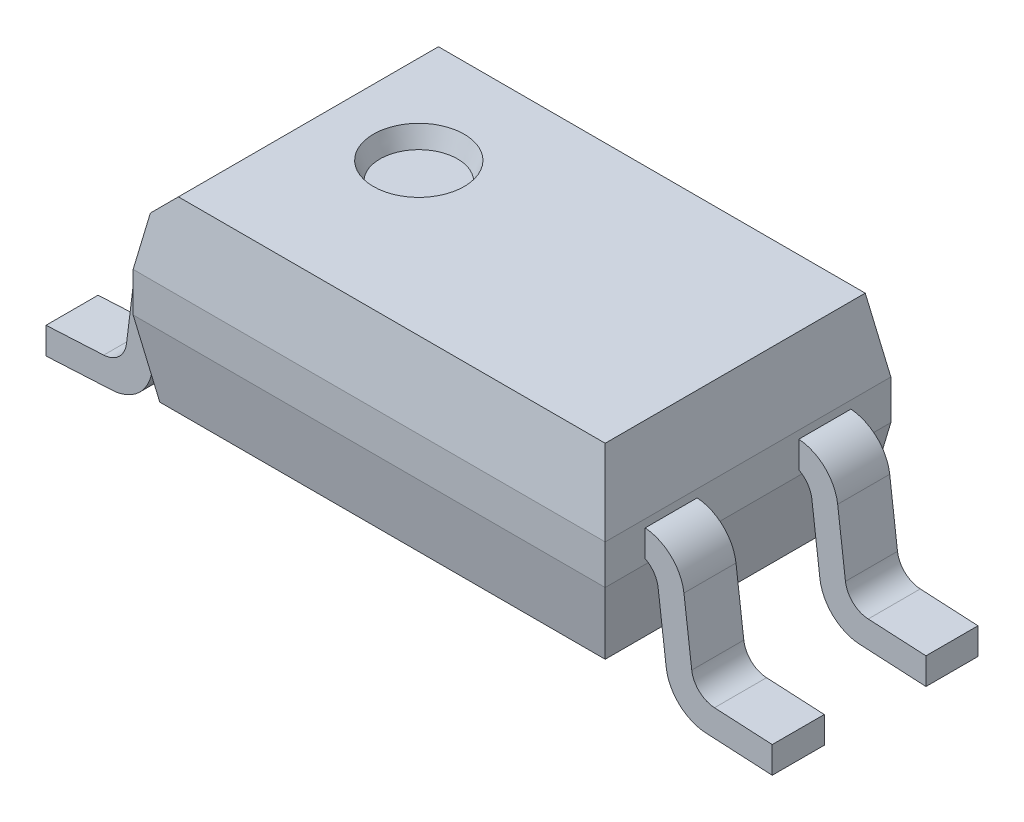
from build123d import *
from OCP.BRepFilletAPI import BRepFilletAPI_MakeChamfer

# Parameters (mm, degrees)
SKETCH1_W            = 3.9
SKETCH1_H            = 2.36
BOSS_EXTRUDE1_DEPTH  = 1.55
CHAMFER1_SIZE        = 0.11
CHAMFER1_SIZE2       = 0.623841
CHAMFER2_SIZE        = 0.6
CHAMFER2_SIZE2       = 0.105796188
CHAMFER3_SIZE        = 0.2
CHAMFER3_SIZE2       = 0.162231915
SKETCH3_R            = 0.375
MARK_PIN1_DEPTH      = 0.15
MARK_PIN1_DRAFT      = -20
PIN_EXTRUDE_DEPTH    = 0.43
FILLET1_R            = 0.2
FILLET2_R            = 0.35
FILLET1_OF_MIRROR1_R = 0.2
FILLET2_OF_MIRROR1_R = 0.35
PIN_PATTERN_START    = 0.42
PIN_PATTERN_DEPTH    = 0.43


# Read off the part's stored shape, not the designer's step: pin_pattern
with BuildPart() as part:
    # Sketch1 → Boss-Extrude1 (new body)
    with BuildSketch(Plane(origin=(0, 0.36, 0), x_dir=(1, 0, 0), z_dir=(0, 1, 0))):
        Rectangle(SKETCH1_W, SKETCH1_H)
    extrude(amount=BOSS_EXTRUDE1_DEPTH)

    # Chamfer1
    chamfer1_edges = [part.edges().sort_by_distance(p)[0] for p in [
        (0, 0.36, 1.18),
        (-1.95, 0.36, 0),
        (0, 0.36, -1.18),
        (1.95, 0.36, 0),
    ]]
    chamfer1_side = [part.faces().sort_by_distance(p)[0] for p in [
        (0, 0.36, 0),
    ]]
    chamfer(chamfer1_edges, length=CHAMFER1_SIZE, length2=CHAMFER1_SIZE2, reference=chamfer1_side[0])

    # Chamfer2: one chamfer whose edges measure the first distance from different faces: ONE call of the kernel's chamfer builder (chamfer() names one face for all edges)
    chamfer2_edges_1 = [part.edges().sort_by_distance(p)[0] for p in [
        (-1.95, 1.91, 0),
    ]]
    chamfer2_side_1 = [part.faces().sort_by_distance(p)[0] for p in [
        (-1.95, 1.4469205, 0),
    ]]
    chamfer2_edges_2 = [part.edges().sort_by_distance(p)[0] for p in [
        (0, 1.91, 1.18),
    ]]
    chamfer2_side_2 = [part.faces().sort_by_distance(p)[0] for p in [
        (0, 1.4469205, 1.18),
    ]]
    chamfer2_edges_3 = [part.edges().sort_by_distance(p)[0] for p in [
        (1.95, 1.91, 0),
    ]]
    chamfer2_side_3 = [part.faces().sort_by_distance(p)[0] for p in [
        (1.95, 1.4469205, 0),
    ]]
    chamfer2_edges_4 = [part.edges().sort_by_distance(p)[0] for p in [
        (0, 1.91, -1.18),
    ]]
    chamfer2_side_4 = [part.faces().sort_by_distance(p)[0] for p in [
        (0, 1.4469205, -1.18),
    ]]
    chamfer2 = BRepFilletAPI_MakeChamfer(part.part.solid().wrapped)
    for e in chamfer2_edges_1:
        chamfer2.Add(CHAMFER2_SIZE, CHAMFER2_SIZE2, e.wrapped, chamfer2_side_1[0].wrapped)  # the first distance lies on this face
    for e in chamfer2_edges_2:
        chamfer2.Add(CHAMFER2_SIZE, CHAMFER2_SIZE2, e.wrapped, chamfer2_side_2[0].wrapped)  # the first distance lies on this face
    for e in chamfer2_edges_3:
        chamfer2.Add(CHAMFER2_SIZE, CHAMFER2_SIZE2, e.wrapped, chamfer2_side_3[0].wrapped)  # the first distance lies on this face
    for e in chamfer2_edges_4:
        chamfer2.Add(CHAMFER2_SIZE, CHAMFER2_SIZE2, e.wrapped, chamfer2_side_4[0].wrapped)  # the first distance lies on this face
    add(Compound.cast(chamfer2.Shape()), mode=Mode.REPLACE)

    # Chamfer3
    chamfer3_edges = [part.edges().sort_by_distance(p)[0] for p in [
        (-1.844203812, 1.91, 0),
    ]]
    chamfer3_side = [part.faces().sort_by_distance(p)[0] for p in [
        (-1.897929458, 1.605306716, 0),
    ]]
    chamfer(chamfer3_edges, length=CHAMFER3_SIZE, length2=CHAMFER3_SIZE2, reference=chamfer3_side[0])


with BuildPart() as mark_pin1_tool:
    # Sketch3 → mark pin1 (with draft: the straight prism first)
    with BuildSketch(Plane(origin=(0, 1.91, 0), x_dir=(1, 0, 0), z_dir=(0, 1, 0))):
        with Locations((-0.95, 0.18)):
            Circle(SKETCH3_R)
    extrude(amount=-MARK_PIN1_DEPTH)
    # mark pin1: the draft: its side faces are tilted about the plane it starts from
    mark_pin1_sides = [mark_pin1_tool.faces().sort_by_distance(p)[0] for p in [
        (-1.325, 1.835, -0.18),
    ]]
    draft(mark_pin1_sides, Plane(origin=(0, 1.91, 0), x_dir=(1, 0, 0), z_dir=(0, 1, 0)), MARK_PIN1_DRAFT)


with BuildPart() as part_1:
    add(part.part)

    # mark pin1: cut by mark_pin1_tool
    add(mark_pin1_tool.part, mode=Mode.SUBTRACT)

    # Sketch2 → pin extrude (add)
    with BuildSketch(Plane(origin=(0, 0, -0.85), x_dir=(-1, 0, 0), z_dir=(0, 0, -1))):
        Polygon((3, 0), (3, 0.22), (2.355650355, 0.253768934), (2.232596609, 1.245), (0, 1.245), (0, 1.025), (2.038219161, 1.025), (2.16, 0.044022535), align=None)
    pin_extrude = extrude(amount=-PIN_EXTRUDE_DEPTH)

    # Fillet1
    # the kernel refuses this fillet: 0.2 mm, written as the material it adds along each edge
    with BuildSketch(Plane(origin=(-2.355650355, 0.253768934, -0.85), x_dir=(0.1231966593163618, 0.9923822767126025, 0), z_dir=(0, 0, 1))) as fillet1_piece_1:
        with BuildLine():
            CenterArc((FILLET1_R * 0.837960751352, FILLET1_R), FILLET1_R, 190.076627033, 79.923372967)
            Line((-FILLET1_R * 0.146613884969, FILLET1_R * 0.825034902013), (-FILLET1_R * 0.166305377696, FILLET1_R * 0.821535600054))
            Line((-FILLET1_R * 0.166305377696, FILLET1_R * 0.821535600054), (-FILLET1_R * 0.016759215027, -FILLET1_R * 0.02))
            Line((-FILLET1_R * 0.016759215027, -FILLET1_R * 0.02), (FILLET1_R * 0.837960751352, -FILLET1_R * 0.02))
            Line((FILLET1_R * 0.837960751352, -FILLET1_R * 0.02), (FILLET1_R * 0.837960751352, 0))
        make_face()
    extrude(amount=0.43)
    with BuildSketch(Plane(origin=(-2.038219161, 1.025, -0.85), x_dir=(1, 0, 0), z_dir=(0, 0, 1))) as fillet1_piece_2:
        with BuildLine():
            CenterArc((0.179439713, -0.177985423), FILLET1_R, 117.135910173, 55.787462794)
            Line((-0.019036743, -0.153346091), (-0.023006272, -0.152853305))
            Line((-0.023006272, -0.152853305), (-0.003969529, 0.000492787))
            Line((-0.003969529, 0.000492787), (0, 0.004))
            ThreePointArc((0, 0.004), (0.04410958, 0.004), (0.08639475, 0.003559708))
            Line((0.08639475, 0.003559708), (0.088219161, 0))
        make_face()
    extrude(amount=0.43)

    # Fillet2
    # the kernel refuses this fillet: 0.35 mm, written as the material it takes off along each edge
    with BuildSketch(Plane(origin=(-2.16, 0.044022535, -1.583215657), x_dir=(0.12319665931636148, 0.9923822767126025, 0), z_dir=(0, 0, 1))) as fillet2_piece_1:
        with BuildLine():
            CenterArc((FILLET2_R * 0.837960751352, FILLET2_R), FILLET2_R, 190.076627033, 79.923372967)
            Line((-FILLET2_R * 0.146613884969, FILLET2_R * 0.825034902013), (-FILLET2_R * 0.166305377696, FILLET2_R * 0.821535600054))
            Line((-FILLET2_R * 0.166305377696, FILLET2_R * 0.821535600054), (-FILLET2_R * 0.016759215027, -FILLET2_R * 0.02))
            Line((-FILLET2_R * 0.016759215027, -FILLET2_R * 0.02), (FILLET2_R * 0.837960751352, -FILLET2_R * 0.02))
            Line((FILLET2_R * 0.837960751352, -FILLET2_R * 0.02), (FILLET2_R * 0.837960751352, 0))
        make_face()
    extrude(amount=1.896431315, mode=Mode.SUBTRACT)
    with BuildSketch(Plane(origin=(-2.232596609, 1.245, -1.620509776), x_dir=(1, 0, 0), z_dir=(0, 0, 1))) as fillet2_piece_2:
        with BuildLine():
            CenterArc((0.309364105, -0.348974929), FILLET2_R, 94.386181504, 78.537191463)
            Line((-0.037969692, -0.305856098), (-0.044916368, -0.304993722))
            Line((-0.044916368, -0.304993722), (-0.006946676, 0.000862377))
            Line((-0.006946676, 0.000862377), (0, 0.007))
            ThreePointArc((0, 0.007), (0.141298305, 0.007), (0.282061259, 0.006979499))
            Line((0.282061259, 0.006979499), (0.282596609, 0))
        make_face()
    extrude(amount=1.971019553, mode=Mode.SUBTRACT)

    # Mirror1: pin extrude across plane
    add(pin_extrude.mirror(Plane(origin=(0, 0, 0), x_dir=(0, 0, 1), z_dir=(1, 0, 0))))

    # Fillet1 of Mirror1
    # the kernel refuses this fillet: 0.2 mm, written as the material it adds along each edge
    with BuildSketch(Plane(origin=(2.355650355, 0.253768934, -0.85), x_dir=(-0.1231966593163618, 0.9923822767126025, 0), z_dir=(0, 0, 1))) as fillet1_of_mirror1_piece_1:
        with BuildLine():
            CenterArc((FILLET1_OF_MIRROR1_R * 0.837960751352, -FILLET1_OF_MIRROR1_R), FILLET1_OF_MIRROR1_R, 90, 79.923372967)
            Line((-FILLET1_OF_MIRROR1_R * 0.146613884969, -FILLET1_OF_MIRROR1_R * 0.825034902013), (-FILLET1_OF_MIRROR1_R * 0.166305377696, -FILLET1_OF_MIRROR1_R * 0.821535600054))
            Line((-FILLET1_OF_MIRROR1_R * 0.166305377696, -FILLET1_OF_MIRROR1_R * 0.821535600054), (-FILLET1_OF_MIRROR1_R * 0.016759215027, FILLET1_OF_MIRROR1_R * 0.02))
            Line((-FILLET1_OF_MIRROR1_R * 0.016759215027, FILLET1_OF_MIRROR1_R * 0.02), (FILLET1_OF_MIRROR1_R * 0.837960751352, FILLET1_OF_MIRROR1_R * 0.02))
            Line((FILLET1_OF_MIRROR1_R * 0.837960751352, FILLET1_OF_MIRROR1_R * 0.02), (FILLET1_OF_MIRROR1_R * 0.837960751352, 0))
        make_face()
    extrude(amount=0.43)
    with BuildSketch(Plane(origin=(2.038219161, 1.025, -0.85), x_dir=(-1, 0, 0), z_dir=(0, 0, 1))) as fillet1_of_mirror1_piece_2:
        with BuildLine():
            CenterArc((0.179439713, 0.177985423), FILLET1_OF_MIRROR1_R, 187.076627033, 55.787462794)
            Line((-0.019036743, 0.153346091), (-0.023006272, 0.152853305))
            Line((-0.023006272, 0.152853305), (-0.003969529, -0.000492787))
            Line((-0.003969529, -0.000492787), (0, -0.004))
            ThreePointArc((0, -0.004), (0.04410958, -0.004), (0.08639475, -0.003559708))
            Line((0.08639475, -0.003559708), (0.088219161, 0))
        make_face()
    extrude(amount=0.43)

    # Fillet2 of Mirror1
    # the kernel refuses this fillet: 0.35 mm, written as the material it takes off along each edge
    with BuildSketch(Plane(origin=(2.16, 0.044022535, -1.583215657), x_dir=(-0.12319665931636148, 0.9923822767126025, 0), z_dir=(0, 0, 1))) as fillet2_of_mirror1_piece_1:
        with BuildLine():
            CenterArc((FILLET2_OF_MIRROR1_R * 0.837960751352, -FILLET2_OF_MIRROR1_R), FILLET2_OF_MIRROR1_R, 90, 79.923372967)
            Line((-FILLET2_OF_MIRROR1_R * 0.146613884969, -FILLET2_OF_MIRROR1_R * 0.825034902013), (-FILLET2_OF_MIRROR1_R * 0.166305377696, -FILLET2_OF_MIRROR1_R * 0.821535600054))
            Line((-FILLET2_OF_MIRROR1_R * 0.166305377696, -FILLET2_OF_MIRROR1_R * 0.821535600054), (-FILLET2_OF_MIRROR1_R * 0.016759215027, FILLET2_OF_MIRROR1_R * 0.02))
            Line((-FILLET2_OF_MIRROR1_R * 0.016759215027, FILLET2_OF_MIRROR1_R * 0.02), (FILLET2_OF_MIRROR1_R * 0.837960751352, FILLET2_OF_MIRROR1_R * 0.02))
            Line((FILLET2_OF_MIRROR1_R * 0.837960751352, FILLET2_OF_MIRROR1_R * 0.02), (FILLET2_OF_MIRROR1_R * 0.837960751352, 0))
        make_face()
    extrude(amount=1.896431315, mode=Mode.SUBTRACT)
    with BuildSketch(Plane(origin=(2.232596609, 1.245, -1.620509776), x_dir=(-1, 0, 0), z_dir=(0, 0, 1))) as fillet2_of_mirror1_piece_2:
        with BuildLine():
            CenterArc((0.309364105, 0.348974929), FILLET2_OF_MIRROR1_R, 187.076627033, 78.537191463)
            Line((-0.037969692, 0.305856098), (-0.044916368, 0.304993722))
            Line((-0.044916368, 0.304993722), (-0.006946676, -0.000862377))
            Line((-0.006946676, -0.000862377), (0, -0.007))
            ThreePointArc((0, -0.007), (0.141298305, -0.007), (0.282061259, -0.006979499))
            Line((0.282061259, -0.006979499), (0.282596609, 0))
        make_face()
    extrude(amount=1.971019553, mode=Mode.SUBTRACT)

    # pin_pattern outline → pin_pattern (add)
    with BuildSketch(Plane.XY.offset(PIN_PATTERN_START)):
        with BuildLine():
            Line((-3, 0.22), (-3, 0))
            Line((-3, 0), (-2.452884324, 0.028673118))
            ThreePointArc((-2.452884324, 0.028673118), (-2.232673705, 0.122060099), (-2.123868112, 0.335074624))
            Line((-2.123868112, 0.335074624), (-2.057255903, 0.871653909))
            ThreePointArc((-2.057255903, 0.871653909), (-2.022669182, 0.961645092), (-1.95, 1.025))
            Line((-1.95, 1.025), (-1.95, 1.245))
            ThreePointArc((-1.95, 1.245), (-2.164841553, 1.149254349), (-2.270566301, 0.939143902))
            Line((-2.270566301, 0.939143902), (-2.335003562, 0.420084414))
            ThreePointArc((-2.335003562, 0.420084414), (-2.397178186, 0.298361828), (-2.523012826, 0.244997839))
            Line((-2.523012826, 0.244997839), (-3, 0.22))
        make_face()
        with BuildLine():
            Line((2.452884324, 0.028673118), (3, 0))
            Line((3, 0), (3, 0.22))
            Line((3, 0.22), (2.523012826, 0.244997839))
            ThreePointArc((2.523012826, 0.244997839), (2.397178186, 0.298361828), (2.335003562, 0.420084414))
            Line((2.335003562, 0.420084414), (2.270566301, 0.939143902))
            ThreePointArc((2.270566301, 0.939143902), (2.164841553, 1.149254349), (1.95, 1.245))
            Line((1.95, 1.245), (1.95, 1.025))
            ThreePointArc((1.95, 1.025), (2.022669182, 0.961645092), (2.057255903, 0.871653909))
            Line((2.057255903, 0.871653909), (2.123868112, 0.335074624))
            ThreePointArc((2.123868112, 0.335074624), (2.232673705, 0.122060099), (2.452884324, 0.028673118))
        make_face()
    extrude(amount=PIN_PATTERN_DEPTH)


solid = part_1.part
